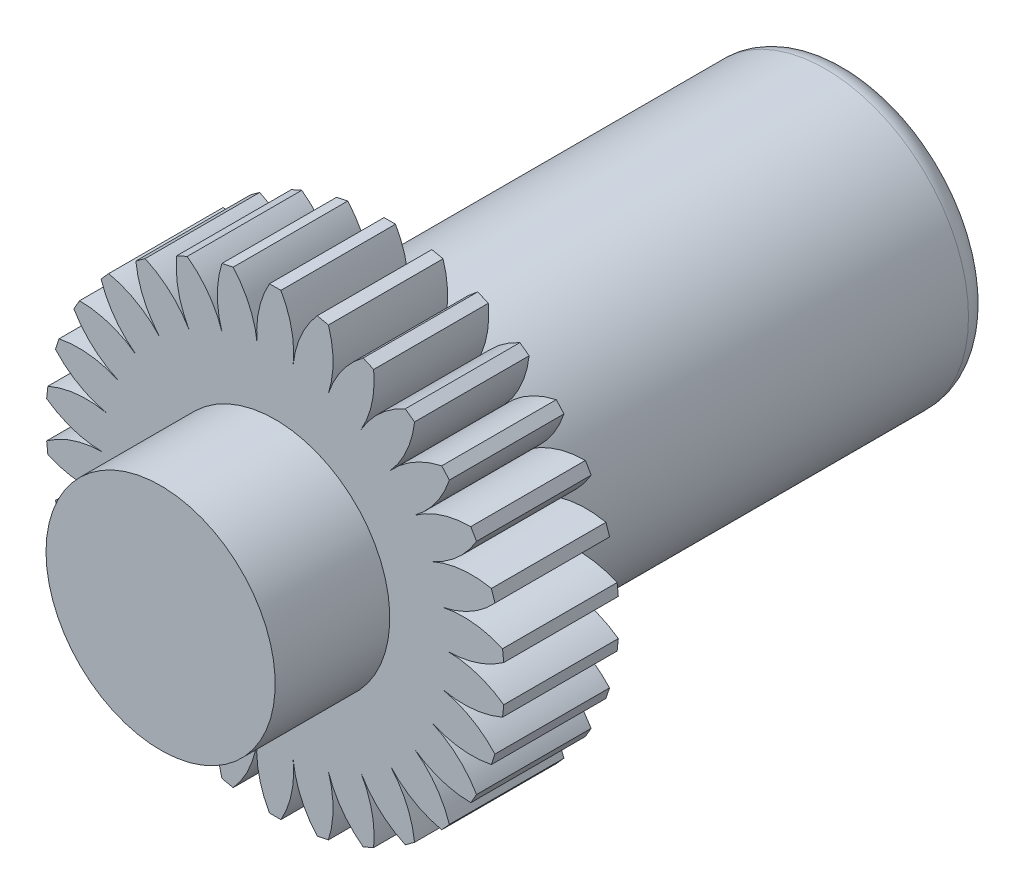
from build123d import *

# Parameters (mm, degrees)
SKETCH_1_R               = 15
EXTRUDE_1_DEPTH          = 10
SKETCH_2_R               = 12.5
EXTRUDE_2_DEPTH          = 40
FILLET_2_R               = 2
FILLET_3_R               = 2
SKETCH_3_R               = 1.25
CUT_EXTRUDE_1_DEPTH      = 30
EXTRUDE_START            = -10
EXTRUDE_3_DEPTH          = 10
PATTERN_CIRCULAR_1_DEPTH = 10
SKETCH_5_R               = 10
EXTRUDE_4_DEPTH          = 10


# Read off the part's stored shape, not the designer's step: 阵列(圆周)1
with BuildPart() as part:
    # 草图1 → 凸台-拉伸1 (new body)
    with BuildSketch(Plane.XY):
        Circle(SKETCH_1_R)
    extrude(amount=EXTRUDE_1_DEPTH)

    # 草图2 → 凸台-拉伸2 (add)
    with BuildSketch(Plane(origin=(0, 0, 0), x_dir=(-1, 0, 0), z_dir=(0, 0, -1))):
        Circle(SKETCH_2_R)
    extrude(amount=EXTRUDE_2_DEPTH)

    # 圆角2
    fillet_2_edges = [part.edges().sort_by_distance(p)[0] for p in [
        (12.5, 0, 0),
    ]]
    fillet(fillet_2_edges, radius=FILLET_2_R)

    # 圆角3
    fillet_3_edges = [part.edges().sort_by_distance(p)[0] for p in [
        (12.5, 0, -40),
    ]]
    fillet(fillet_3_edges, radius=FILLET_3_R)

    # 草图3 → 切除-拉伸1 (cut)
    with BuildSketch(Plane.XY.offset(10)):
        Circle(SKETCH_3_R)
    extrude(amount=-CUT_EXTRUDE_1_DEPTH, mode=Mode.SUBTRACT)

    # 草图4 → 凸台-拉伸3 (add)
    with BuildSketch(Plane.XY.offset(10).offset(EXTRUDE_START)):
        with BuildLine():
            Line((-0.5, 20), (0.5, 20))
            ThreePointArc((0.5, 20), (1.433409728, 17.542850661), (1.567926949, 14.917828431))
            ThreePointArc((1.567926949, 14.917828431), (0, 15), (-1.567926949, 14.917828431))
            ThreePointArc((-1.567926949, 14.917828431), (-1.433409728, 17.542850661), (-0.5, 20))
        make_face()
    extrude(amount=EXTRUDE_3_DEPTH)

    # 阵列(圆周)1 outline → 阵列(圆周)1 (add)
    with BuildSketch(Plane.XY):
        with BuildLine():
            ThreePointArc((-4.635254916, 14.265847745), (-3.118675363, 14.672214011), (-1.567926949, 14.917828431))
            ThreePointArc((-1.567926949, 14.917828431), (-2.245277457, 17.457519924), (-3.669160016, 19.66690786))
            Line((-3.669160016, 19.66690786), (-4.647307617, 19.458996169))
            ThreePointArc((-4.647307617, 19.458996169), (-5.049450029, 16.861474644), (-4.635254916, 14.265847745))
        make_face()
        with BuildLine():
            ThreePointArc((1.567926949, 14.917828431), (3.118675363, 14.672214011), (4.635254916, 14.265847745))
            ThreePointArc((4.635254916, 14.265847745), (5.049450029, 16.861474644), (4.647307617, 19.458996169))
            Line((4.647307617, 19.458996169), (3.669160016, 19.66690786))
            ThreePointArc((3.669160016, 19.66690786), (2.245277457, 17.457519924), (1.567926949, 14.917828431))
        make_face()
        with BuildLine():
            ThreePointArc((4.635254916, 14.265847745), (6.101049646, 13.703181865), (7.5, 12.990381057))
            ThreePointArc((7.5, 12.990381057), (8.444805133, 15.443171275), (8.59150559, 18.067540831))
            Line((8.59150559, 18.067540831), (7.677960133, 18.474277474))
            ThreePointArc((7.677960133, 18.474277474), (5.825835242, 16.609211796), (4.635254916, 14.265847745))
        make_face()
        with BuildLine():
            ThreePointArc((7.5, 12.990381057), (8.816778785, 12.135254916), (10.036959096, 11.147172383))
            ThreePointArc((10.036959096, 11.147172383), (11.471081731, 13.349927216), (12.160213543, 15.886447261))
            Line((12.160213543, 15.886447261), (11.351196549, 16.474232514))
            ThreePointArc((11.351196549, 16.474232514), (9.151776072, 15.035001413), (7.5, 12.990381057))
        make_face()
        with BuildLine():
            ThreePointArc((10.036959096, 11.147172383), (11.147172383, 10.036959096), (12.135254916, 8.816778784))
            ThreePointArc((12.135254916, 8.816778784), (13.996017013, 10.673227278), (15.197461813, 13.011039714))
            Line((15.197461813, 13.011039714), (14.528331206, 13.75418454))
            ThreePointArc((14.528331206, 13.75418454), (12.077740372, 12.803689322), (10.036959096, 11.147172383))
        make_face()
        with BuildLine():
            ThreePointArc((12.135254916, 8.816778784), (12.990381057, 7.5), (13.703181865, 6.101049646))
            ThreePointArc((13.703181865, 6.101049646), (15.909259191, 7.530056092), (17.570508076, 9.566987298))
            Line((17.570508076, 9.566987298), (17.070508076, 10.433012702))
            ThreePointArc((17.070508076, 10.433012702), (14.475849464, 10.012794569), (12.135254916, 8.816778784))
        make_face()
        with BuildLine():
            ThreePointArc((13.703181865, 6.101049646), (14.265847745, 4.635254915), (14.672214011, 3.118675362))
            ThreePointArc((14.672214011, 3.118675362), (17.127190401, 4.057785322), (19.175638823, 5.704811629))
            Line((19.175638823, 5.704811629), (18.866621829, 6.655868146))
            ThreePointArc((18.866621829, 6.655868146), (16.24129447, 6.784292646), (13.703181865, 6.101049646))
        make_face()
        with BuildLine():
            ThreePointArc((14.672214011, 3.118675362), (14.917828431, 1.567926949), (15, 0))
            ThreePointArc((15, 0), (17.596581206, 0.408169862), (19.942702139, 1.593308318))
            Line((19.942702139, 1.593308318), (19.838173676, 2.587830213))
            ThreePointArc((19.838173676, 2.587830213), (17.296916974, 3.25928458), (14.672214011, 3.118675362))
        make_face()
        with BuildLine():
            ThreePointArc((15, 0), (14.917828431, -1.567926949), (14.672214011, -3.118675362))
            ThreePointArc((14.672214011, -3.118675362), (17.296916974, -3.25928458), (19.838173676, -2.587830213))
            Line((19.838173676, -2.587830213), (19.942702139, -1.593308318))
            ThreePointArc((19.942702139, -1.593308318), (17.596581206, -0.408169862), (15, 0))
        make_face()
        with BuildLine():
            ThreePointArc((14.672214011, -3.118675362), (14.265847745, -4.635254915), (13.703181865, -6.101049646))
            ThreePointArc((13.703181865, -6.101049646), (16.24129447, -6.784292646), (18.866621829, -6.655868146))
            Line((18.866621829, -6.655868146), (19.175638823, -5.704811629))
            ThreePointArc((19.175638823, -5.704811629), (17.127190401, -4.057785322), (14.672214011, -3.118675362))
        make_face()
        with BuildLine():
            ThreePointArc((13.703181865, -6.101049646), (12.990381057, -7.5), (12.135254916, -8.816778784))
            ThreePointArc((12.135254916, -8.816778784), (14.475849464, -10.012794569), (17.070508076, -10.433012702))
            Line((17.070508076, -10.433012702), (17.570508076, -9.566987298))
            ThreePointArc((17.570508076, -9.566987298), (15.909259191, -7.530056092), (13.703181865, -6.101049646))
        make_face()
        with BuildLine():
            ThreePointArc((12.135254916, -8.816778784), (11.147172382, -10.036959095), (10.036959095, -11.147172382))
            ThreePointArc((10.036959095, -11.147172382), (12.077740372, -12.803689322), (14.528331206, -13.75418454))
            Line((14.528331206, -13.75418454), (15.197461813, -13.011039714))
            ThreePointArc((15.197461813, -13.011039714), (13.996017013, -10.673227278), (12.135254916, -8.816778784))
        make_face()
        with BuildLine():
            ThreePointArc((10.036959095, -11.147172382), (8.816778784, -12.135254916), (7.5, -12.990381057))
            ThreePointArc((7.5, -12.990381057), (9.151776072, -15.035001413), (11.351196549, -16.474232514))
            Line((11.351196549, -16.474232514), (12.160213543, -15.886447261))
            ThreePointArc((12.160213543, -15.886447261), (11.471081731, -13.349927216), (10.036959095, -11.147172382))
        make_face()
        with BuildLine():
            ThreePointArc((7.5, -12.990381057), (6.101049646, -13.703181865), (4.635254916, -14.265847744))
            ThreePointArc((4.635254916, -14.265847744), (5.825835242, -16.609211796), (7.677960133, -18.474277474))
            Line((7.677960133, -18.474277474), (8.59150559, -18.067540831))
            ThreePointArc((8.59150559, -18.067540831), (8.444805133, -15.443171275), (7.5, -12.990381057))
        make_face()
        with BuildLine():
            ThreePointArc((4.635254916, -14.265847744), (3.118675362, -14.672214011), (1.567926949, -14.917828431))
            ThreePointArc((1.567926949, -14.917828431), (2.245277457, -17.457519924), (3.669160016, -19.66690786))
            Line((3.669160016, -19.66690786), (4.647307617, -19.458996169))
            ThreePointArc((4.647307617, -19.458996169), (5.049450029, -16.861474644), (4.635254916, -14.265847744))
        make_face()
        with BuildLine():
            ThreePointArc((1.567926949, -14.917828431), (0, -15), (-1.567926949, -14.917828431))
            ThreePointArc((-1.567926949, -14.917828431), (-1.433409728, -17.542850661), (-0.5, -20))
            Line((-0.5, -20), (0.5, -20))
            ThreePointArc((0.5, -20), (1.433409728, -17.542850661), (1.567926949, -14.917828431))
        make_face()
        with BuildLine():
            ThreePointArc((-1.567926949, -14.917828431), (-3.118675362, -14.672214011), (-4.635254916, -14.265847744))
            ThreePointArc((-4.635254916, -14.265847744), (-5.049450029, -16.861474644), (-4.647307617, -19.458996169))
            Line((-4.647307617, -19.458996169), (-3.669160016, -19.66690786))
            ThreePointArc((-3.669160016, -19.66690786), (-2.245277457, -17.457519924), (-1.567926949, -14.917828431))
        make_face()
        with BuildLine():
            ThreePointArc((-4.635254916, -14.265847744), (-6.101049646, -13.703181865), (-7.5, -12.990381057))
            ThreePointArc((-7.5, -12.990381057), (-8.444805133, -15.443171275), (-8.59150559, -18.067540831))
            Line((-8.59150559, -18.067540831), (-7.677960133, -18.474277474))
            ThreePointArc((-7.677960133, -18.474277474), (-5.825835242, -16.609211796), (-4.635254916, -14.265847744))
        make_face()
        with BuildLine():
            ThreePointArc((-7.5, -12.990381057), (-8.816778784, -12.135254916), (-10.036959095, -11.147172382))
            ThreePointArc((-10.036959095, -11.147172382), (-11.471081731, -13.349927216), (-12.160213543, -15.886447261))
            Line((-12.160213543, -15.886447261), (-11.351196549, -16.474232514))
            ThreePointArc((-11.351196549, -16.474232514), (-9.151776072, -15.035001413), (-7.5, -12.990381057))
        make_face()
        with BuildLine():
            ThreePointArc((-10.036959095, -11.147172382), (-11.147172382, -10.036959095), (-12.135254916, -8.816778784))
            ThreePointArc((-12.135254916, -8.816778784), (-13.996017013, -10.673227278), (-15.197461813, -13.011039714))
            Line((-15.197461813, -13.011039714), (-14.528331206, -13.75418454))
            ThreePointArc((-14.528331206, -13.75418454), (-12.077740372, -12.803689322), (-10.036959095, -11.147172382))
        make_face()
        with BuildLine():
            ThreePointArc((-12.135254916, -8.816778784), (-12.990381057, -7.5), (-13.703181865, -6.101049646))
            ThreePointArc((-13.703181865, -6.101049646), (-15.909259191, -7.530056092), (-17.570508076, -9.566987298))
            Line((-17.570508076, -9.566987298), (-17.070508076, -10.433012702))
            ThreePointArc((-17.070508076, -10.433012702), (-14.475849464, -10.012794569), (-12.135254916, -8.816778784))
        make_face()
        with BuildLine():
            ThreePointArc((-13.703181865, -6.101049646), (-14.265847745, -4.635254915), (-14.672214011, -3.118675362))
            ThreePointArc((-14.672214011, -3.118675362), (-17.127190401, -4.057785322), (-19.175638823, -5.704811629))
            Line((-19.175638823, -5.704811629), (-18.866621829, -6.655868146))
            ThreePointArc((-18.866621829, -6.655868146), (-16.24129447, -6.784292646), (-13.703181865, -6.101049646))
        make_face()
        with BuildLine():
            ThreePointArc((-14.672214011, -3.118675362), (-14.917828431, -1.567926949), (-15, 0))
            ThreePointArc((-15, 0), (-17.596581206, -0.408169862), (-19.942702139, -1.593308318))
            Line((-19.942702139, -1.593308318), (-19.838173676, -2.587830213))
            ThreePointArc((-19.838173676, -2.587830213), (-17.296916974, -3.25928458), (-14.672214011, -3.118675362))
        make_face()
        with BuildLine():
            ThreePointArc((-15, 0), (-14.917828431, 1.567926949), (-14.672214011, 3.118675362))
            ThreePointArc((-14.672214011, 3.118675362), (-17.296916974, 3.25928458), (-19.838173676, 2.587830213))
            Line((-19.838173676, 2.587830213), (-19.942702139, 1.593308318))
            ThreePointArc((-19.942702139, 1.593308318), (-17.596581206, 0.408169862), (-15, 0))
        make_face()
        with BuildLine():
            ThreePointArc((-14.672214011, 3.118675362), (-14.265847745, 4.635254915), (-13.703181865, 6.101049646))
            ThreePointArc((-13.703181865, 6.101049646), (-16.24129447, 6.784292646), (-18.866621829, 6.655868146))
            Line((-18.866621829, 6.655868146), (-19.175638823, 5.704811629))
            ThreePointArc((-19.175638823, 5.704811629), (-17.127190401, 4.057785322), (-14.672214011, 3.118675362))
        make_face()
        with BuildLine():
            ThreePointArc((-13.703181865, 6.101049646), (-12.990381057, 7.5), (-12.135254916, 8.816778784))
            ThreePointArc((-12.135254916, 8.816778784), (-14.475849464, 10.012794569), (-17.070508076, 10.433012702))
            Line((-17.070508076, 10.433012702), (-17.570508076, 9.566987298))
            ThreePointArc((-17.570508076, 9.566987298), (-15.909259191, 7.530056092), (-13.703181865, 6.101049646))
        make_face()
        with BuildLine():
            ThreePointArc((-12.135254916, 8.816778784), (-11.147172383, 10.036959096), (-10.036959096, 11.147172383))
            ThreePointArc((-10.036959096, 11.147172383), (-12.077740372, 12.803689322), (-14.528331206, 13.75418454))
            Line((-14.528331206, 13.75418454), (-15.197461813, 13.011039714))
            ThreePointArc((-15.197461813, 13.011039714), (-13.996017013, 10.673227278), (-12.135254916, 8.816778784))
        make_face()
        with BuildLine():
            ThreePointArc((-10.036959096, 11.147172383), (-8.816778785, 12.135254916), (-7.5, 12.990381057))
            ThreePointArc((-7.5, 12.990381057), (-9.151776072, 15.035001413), (-11.351196549, 16.474232514))
            Line((-11.351196549, 16.474232514), (-12.160213543, 15.886447261))
            ThreePointArc((-12.160213543, 15.886447261), (-11.471081731, 13.349927216), (-10.036959096, 11.147172383))
        make_face()
        with BuildLine():
            ThreePointArc((-7.5, 12.990381057), (-6.101049646, 13.703181865), (-4.635254916, 14.265847745))
            ThreePointArc((-4.635254916, 14.265847745), (-5.825835242, 16.609211796), (-7.677960133, 18.474277474))
            Line((-7.677960133, 18.474277474), (-8.59150559, 18.067540831))
            ThreePointArc((-8.59150559, 18.067540831), (-8.444805133, 15.443171275), (-7.5, 12.990381057))
        make_face()
    extrude(amount=PATTERN_CIRCULAR_1_DEPTH)

    # 草图5 → 凸台-拉伸4 (add)
    with BuildSketch(Plane.XY.offset(10)):
        with Locations(Location((0, 0, 0), (0, 0, 180))):
            Circle(SKETCH_5_R)
    extrude(amount=EXTRUDE_4_DEPTH)


solid = part.part
